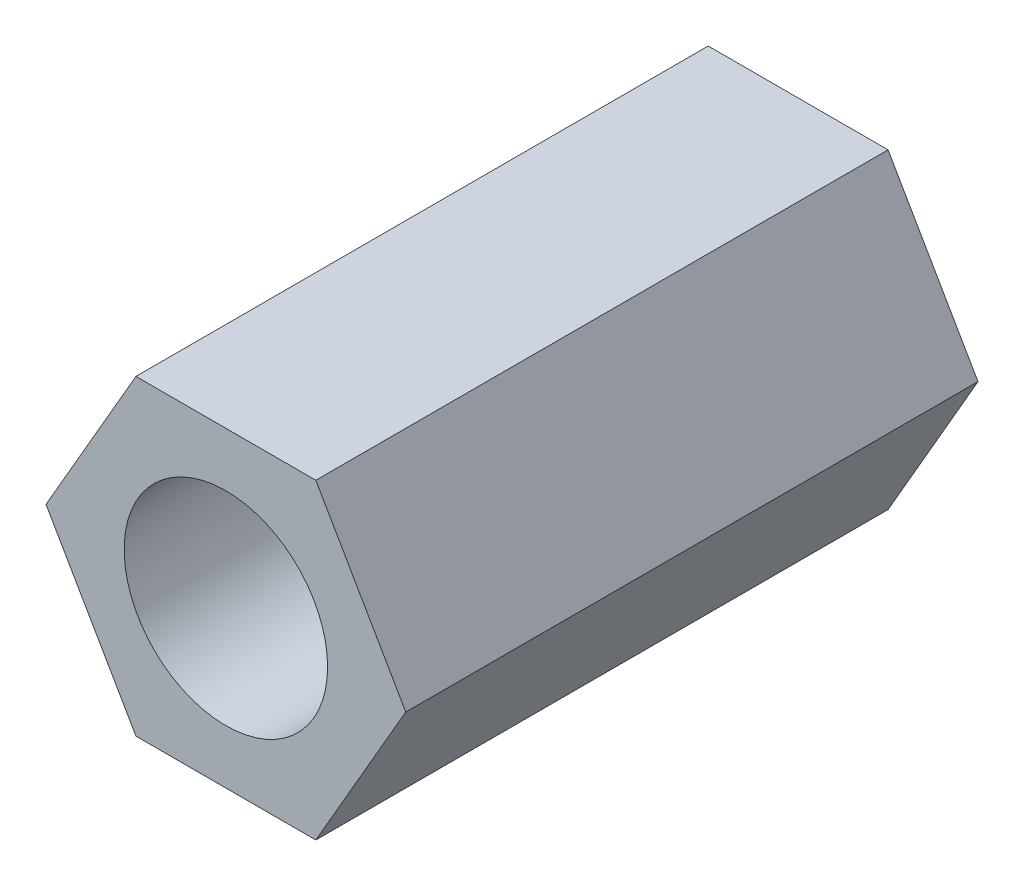
from build123d import *

# Parameters (mm, degrees)
SKETCH_1_R      = 1.6
EXTRUDE_1_DEPTH = 9


with BuildPart() as part:
    # 草图1 → 凸台-拉伸1 (new body)
    with BuildSketch(Plane.XY):
        Polygon((2.829016319, 0), (1.41450816, 2.45), (-1.41450816, 2.45), (-2.829016319, 0), (-1.41450816, -2.45), (1.41450816, -2.45), align=None)
        Circle(SKETCH_1_R, mode=Mode.SUBTRACT)
    extrude(amount=EXTRUDE_1_DEPTH)


solid = part.part
